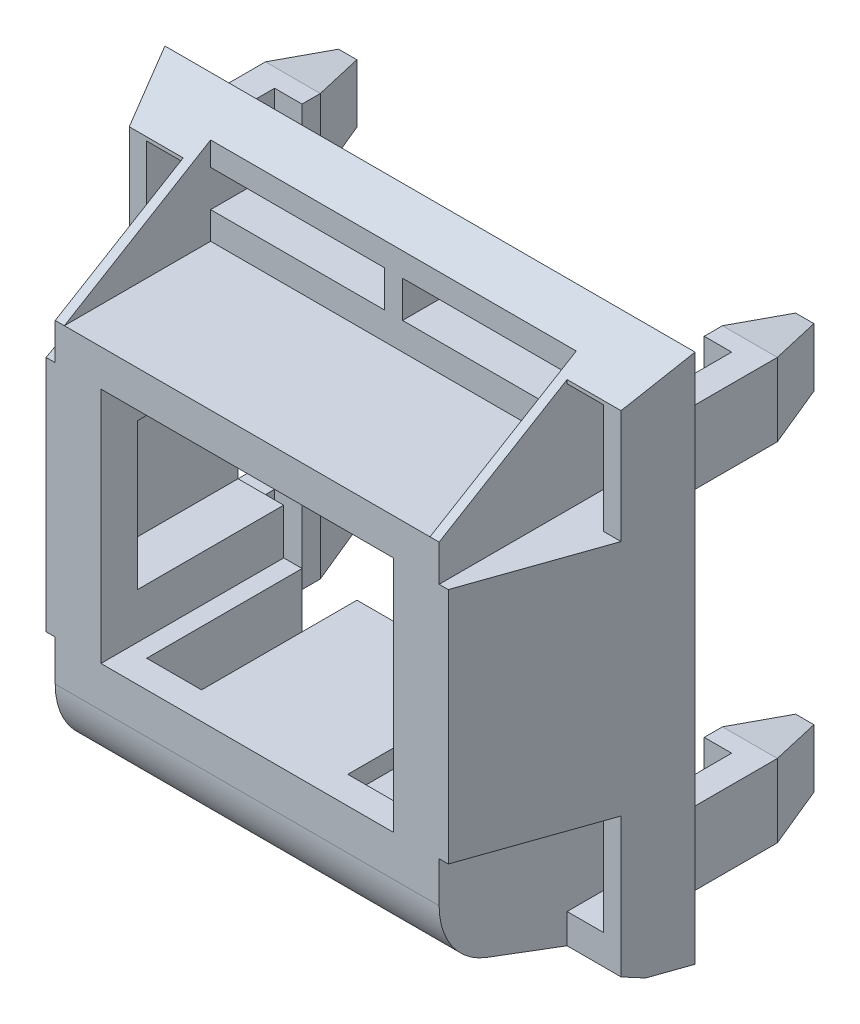
from build123d import *
from OCP.BRepFilletAPI import BRepFilletAPI_MakeChamfer

# Parameters (mm, degrees)
ESQUISSE1_W             = 14.5
ESQUISSE1_H             = 14.5
BOSS_EXTRU_1_DEPTH      = 5
ESQUISSE2_W             = 8
ESQUISSE2_H             = 6.5
ENL_V_MAT_EXTRU_1_DEPTH = 12.407234547
CHANFREIN1_SIZE         = 5
CHANFREIN1_SIZE_2       = 1.75
CHANFREIN2_SIZE         = 5
CHANFREIN2_SIZE_2       = 3
ESQUISSE3_W             = 2
ESQUISSE3_H             = 4
ENL_V_MAT_EXTRU_2_DEPTH = 3.5
ESQUISSE6_W             = 10
ESQUISSE6_H             = 3
ENL_V_MAT_EXTRU_3_DEPTH = 4
CHANFREIN3_SIZE         = 4
CHANFREIN3_SIZE2        = 1.5
CONG_1_R                = 2
ESQUISSE7_W             = 1.25
ESQUISSE7_H             = 4
ENL_V_MAT_EXTRU_4_DEPTH = 4
ESQUISSE8_W             = 1.5
ESQUISSE8_H             = 2
BOSS_EXTRU_2_DEPTH      = 4
CHANFREIN4_SIZE         = 0.2
CHANFREIN4_SIZE2        = 1.5
CHANFREIN5_SIZE         = 1.5
CHANFREIN5_SIZE2        = 0.2
CHANFREIN6_SIZE         = 0.5
CHANFREIN6_SIZE2        = 1.5
CHANFREIN7_SIZE         = 1.5
CHANFREIN7_SIZE2        = 0.5
ESQUISSE9_W             = 1
ESQUISSE9_H             = 3
ENL_V_MAT_EXTRU_5_DEPTH = 3.5
ESQUISSE10_W            = 4.75
ESQUISSE10_H            = 1
ENL_V_MAT_EXTRU_6_DEPTH = 12.407234547
ESQUISSE11_W            = 1.5
ESQUISSE11_H            = 0.5
ENL_V_MAT_EXTRU_7_DEPTH = 4.25
CONG_2_START            = -3.497851783
CONG_2_DEPTH            = 7


with BuildPart() as part:
    # Esquisse1 → Boss.-Extru.1 (new body)
    with BuildSketch(Plane.XY):
        Rectangle(ESQUISSE1_W, ESQUISSE1_H)
    extrude(amount=BOSS_EXTRU_1_DEPTH)

    # Esquisse2 → Enlèv. mat.-Extru.1 (cut, through all)
    with BuildSketch(Plane.XY.offset(5)):
        Rectangle(ESQUISSE2_W, ESQUISSE2_H)
    extrude(amount=-ENL_V_MAT_EXTRU_1_DEPTH, mode=Mode.SUBTRACT)

    # Chanfrein1
    # the kernel refuses this chamfer: 5, 1.75 mm, written as the material it takes off along each edge
    with BuildSketch(Plane(origin=(7.25, 20.222980747, 5), x_dir=(0, 0, -1), z_dir=(0, -1, 0)), Plane(origin=(-7.25, -20.222980747, 5), x_dir=(0, 0, -1), z_dir=(0, 1, 0))) as chanfrein1_piece_1:
        Polygon((CHANFREIN1_SIZE, 0), (0, -CHANFREIN1_SIZE_2), (0, 0), align=None)
    extrude(amount=40.445961493, mode=Mode.SUBTRACT)

    # Chanfrein2
    # the kernel refuses this chamfer: 5, 3 mm, written as the material it takes off along each edge
    with BuildSketch(Plane(origin=(-18.431305486, 7.25, 5), x_dir=(0, 0, -1), z_dir=(1, 0, 0))) as chanfrein2_piece_1:
        Polygon((CHANFREIN2_SIZE, 0), (0, -CHANFREIN2_SIZE_2), (0, 0), align=None)
    extrude(amount=36.862610972, mode=Mode.SUBTRACT)

    # Esquisse3 → Enlèv. mat.-Extru.2 (cut)
    with BuildSketch(Plane.XY.offset(5)):
        with Locations((-6.25, 5.25)):
            Rectangle(ESQUISSE3_W, ESQUISSE3_H)
        with Locations((6.25, 5.25)):
            Rectangle(ESQUISSE3_W, ESQUISSE3_H)
        with Locations((6.25, -5.25)):
            Rectangle(ESQUISSE3_W, ESQUISSE3_H)
        with Locations((-6.25, -5.25)):
            Rectangle(ESQUISSE3_W, ESQUISSE3_H)
    extrude(amount=-ENL_V_MAT_EXTRU_2_DEPTH, mode=Mode.SUBTRACT)

    # Esquisse6 → Enlèv. mat.-Extru.3 (cut)
    with BuildSketch(Plane.XY.offset(5)):
        with Locations((0, 5.75)):
            Rectangle(ESQUISSE6_W, ESQUISSE6_H)
    extrude(amount=-ENL_V_MAT_EXTRU_3_DEPTH, mode=Mode.SUBTRACT)

    # Chanfrein3
    chanfrein3_edges = [part.edges().sort_by_distance(p)[0] for p in [
        (0, -7.25, 5),
    ]]
    chanfrein3_side = [part.faces().sort_by_distance(p)[0] for p in [
        (0, -7.25, 2.338531514),
    ]]
    chamfer(chanfrein3_edges, length=CHANFREIN3_SIZE, length2=CHANFREIN3_SIZE2, reference=chanfrein3_side[0])

    # Congé1
    cong_1_edges = [part.edges().sort_by_distance(p)[0] for p in [
        (0, -5.75, 5),
    ]]
    fillet(cong_1_edges, radius=CONG_1_R)

    # Esquisse7 → Enlèv. mat.-Extru.4 (cut)
    with BuildSketch(Plane(origin=(0, 0, 0), x_dir=(-1, 0, 0), z_dir=(0, 0, -1))):
        with Locations((-4.625, 0)):
            Rectangle(ESQUISSE7_W, ESQUISSE7_H)
        with Locations((4.625, 0)):
            Rectangle(ESQUISSE7_W, ESQUISSE7_H)
    extrude(amount=-ENL_V_MAT_EXTRU_4_DEPTH, mode=Mode.SUBTRACT)

    # Esquisse8 → Boss.-Extru.2 (add)
    with BuildSketch(Plane(origin=(0, 0, 0), x_dir=(-1, 0, 0), z_dir=(0, 0, -1))):
        with Locations((-6.25, 4.75)):
            Rectangle(ESQUISSE8_W, ESQUISSE8_H)
        with Locations((6.25, 4.75)):
            Rectangle(ESQUISSE8_W, ESQUISSE8_H)
        with Locations((6.25, -4.75)):
            Rectangle(ESQUISSE8_W, ESQUISSE8_H)
        with Locations((-6.25, -4.75)):
            Rectangle(ESQUISSE8_W, ESQUISSE8_H)
    extrude(amount=BOSS_EXTRU_2_DEPTH)

    # Chanfrein4: one chamfer whose edges measure the first distance from different faces: ONE call of the kernel's chamfer builder (chamfer() names one face for all edges)
    chanfrein4_edges_1 = [part.edges().sort_by_distance(p)[0] for p in [
        (6.25, 5.75, -4),
    ]]
    chanfrein4_side_1 = [part.faces().sort_by_distance(p)[0] for p in [
        (6.25, 4.75, -4),
    ]]
    chanfrein4_edges_2 = [part.edges().sort_by_distance(p)[0] for p in [
        (-6.25, 3.75, -4),
        (-6.25, 5.75, -4),
    ]]
    chanfrein4_side_2 = [part.faces().sort_by_distance(p)[0] for p in [
        (-6.25, 4.75, -4),
    ]]
    chanfrein4_edges_3 = [part.edges().sort_by_distance(p)[0] for p in [
        (6.25, -3.75, -4),
    ]]
    chanfrein4_side_3 = [part.faces().sort_by_distance(p)[0] for p in [
        (6.25, -4.75, -4),
    ]]
    chanfrein4 = BRepFilletAPI_MakeChamfer(part.part.solid().wrapped)
    for e in chanfrein4_edges_1:
        chanfrein4.Add(CHANFREIN4_SIZE, CHANFREIN4_SIZE2, e.wrapped, chanfrein4_side_1[0].wrapped)  # the first distance lies on this face
    for e in chanfrein4_edges_2:
        chanfrein4.Add(CHANFREIN4_SIZE, CHANFREIN4_SIZE2, e.wrapped, chanfrein4_side_2[0].wrapped)  # the first distance lies on this face
    for e in chanfrein4_edges_3:
        chanfrein4.Add(CHANFREIN4_SIZE, CHANFREIN4_SIZE2, e.wrapped, chanfrein4_side_3[0].wrapped)  # the first distance lies on this face
    add(Compound.cast(chanfrein4.Shape()), mode=Mode.REPLACE)

    # Chanfrein5: one chamfer whose edges measure the first distance from different faces: ONE call of the kernel's chamfer builder (chamfer() names one face for all edges)
    chanfrein5_edges_1 = [part.edges().sort_by_distance(p)[0] for p in [
        (6.25, 3.75, -4),
    ]]
    chanfrein5_side_1 = [part.faces().sort_by_distance(p)[0] for p in [
        (6.25, 3.75, -2),
    ]]
    chanfrein5_edges_2 = [part.edges().sort_by_distance(p)[0] for p in [
        (-6.25, -5.75, -4),
    ]]
    chanfrein5_side_2 = [part.faces().sort_by_distance(p)[0] for p in [
        (-6.25, -5.75, -2),
    ]]
    chanfrein5_edges_3 = [part.edges().sort_by_distance(p)[0] for p in [
        (-6.25, -3.75, -4),
    ]]
    chanfrein5_side_3 = [part.faces().sort_by_distance(p)[0] for p in [
        (-6.25, -3.75, -2),
    ]]
    chanfrein5_edges_4 = [part.edges().sort_by_distance(p)[0] for p in [
        (6.25, -5.75, -4),
    ]]
    chanfrein5_side_4 = [part.faces().sort_by_distance(p)[0] for p in [
        (6.25, -5.75, -2),
    ]]
    chanfrein5 = BRepFilletAPI_MakeChamfer(part.part.solid().wrapped)
    for e in chanfrein5_edges_1:
        chanfrein5.Add(CHANFREIN5_SIZE, CHANFREIN5_SIZE2, e.wrapped, chanfrein5_side_1[0].wrapped)  # the first distance lies on this face
    for e in chanfrein5_edges_2:
        chanfrein5.Add(CHANFREIN5_SIZE, CHANFREIN5_SIZE2, e.wrapped, chanfrein5_side_2[0].wrapped)  # the first distance lies on this face
    for e in chanfrein5_edges_3:
        chanfrein5.Add(CHANFREIN5_SIZE, CHANFREIN5_SIZE2, e.wrapped, chanfrein5_side_3[0].wrapped)  # the first distance lies on this face
    for e in chanfrein5_edges_4:
        chanfrein5.Add(CHANFREIN5_SIZE, CHANFREIN5_SIZE2, e.wrapped, chanfrein5_side_4[0].wrapped)  # the first distance lies on this face
    add(Compound.cast(chanfrein5.Shape()), mode=Mode.REPLACE)

    # Chanfrein6: one chamfer whose edges measure the first distance from different faces: ONE call of the kernel's chamfer builder (chamfer() names one face for all edges)
    chanfrein6_edges_1 = [part.edges().sort_by_distance(p)[0] for p in [
        (5.5, 4.75, -4),
    ]]
    chanfrein6_side_1 = [part.faces().sort_by_distance(p)[0] for p in [
        (6.25, 4.75, -4),
    ]]
    chanfrein6_edges_2 = [part.edges().sort_by_distance(p)[0] for p in [
        (-7, 4.75, -4),
    ]]
    chanfrein6_side_2 = [part.faces().sort_by_distance(p)[0] for p in [
        (-6.25, 4.75, -4),
    ]]
    chanfrein6_edges_3 = [part.edges().sort_by_distance(p)[0] for p in [
        (-5.5, -4.75, -4),
        (-7, -4.75, -4),
    ]]
    chanfrein6_side_3 = [part.faces().sort_by_distance(p)[0] for p in [
        (-6.25, -4.75, -4),
    ]]
    chanfrein6 = BRepFilletAPI_MakeChamfer(part.part.solid().wrapped)
    for e in chanfrein6_edges_1:
        chanfrein6.Add(CHANFREIN6_SIZE, CHANFREIN6_SIZE2, e.wrapped, chanfrein6_side_1[0].wrapped)  # the first distance lies on this face
    for e in chanfrein6_edges_2:
        chanfrein6.Add(CHANFREIN6_SIZE, CHANFREIN6_SIZE2, e.wrapped, chanfrein6_side_2[0].wrapped)  # the first distance lies on this face
    for e in chanfrein6_edges_3:
        chanfrein6.Add(CHANFREIN6_SIZE, CHANFREIN6_SIZE2, e.wrapped, chanfrein6_side_3[0].wrapped)  # the first distance lies on this face
    add(Compound.cast(chanfrein6.Shape()), mode=Mode.REPLACE)

    # Chanfrein7: one chamfer whose edges measure the first distance from different faces: ONE call of the kernel's chamfer builder (chamfer() names one face for all edges)
    chanfrein7_edges_1 = [part.edges().sort_by_distance(p)[0] for p in [
        (5.5, -4.75, -4),
    ]]
    chanfrein7_side_1 = [part.faces().sort_by_distance(p)[0] for p in [
        (5.5, -4.75, -1.941558442),
    ]]
    chanfrein7_edges_2 = [part.edges().sort_by_distance(p)[0] for p in [
        (-5.5, 4.75, -4),
    ]]
    chanfrein7_side_2 = [part.faces().sort_by_distance(p)[0] for p in [
        (-5.5, 4.75, -1.941558442),
    ]]
    chanfrein7_edges_3 = [part.edges().sort_by_distance(p)[0] for p in [
        (7, 4.75, -4),
    ]]
    chanfrein7_side_3 = [part.faces().sort_by_distance(p)[0] for p in [
        (7, 4.75, -1.941558442),
    ]]
    chanfrein7_edges_4 = [part.edges().sort_by_distance(p)[0] for p in [
        (7, -4.75, -4),
    ]]
    chanfrein7_side_4 = [part.faces().sort_by_distance(p)[0] for p in [
        (7, -4.75, -1.941558442),
    ]]
    chanfrein7 = BRepFilletAPI_MakeChamfer(part.part.solid().wrapped)
    for e in chanfrein7_edges_1:
        chanfrein7.Add(CHANFREIN7_SIZE, CHANFREIN7_SIZE2, e.wrapped, chanfrein7_side_1[0].wrapped)  # the first distance lies on this face
    for e in chanfrein7_edges_2:
        chanfrein7.Add(CHANFREIN7_SIZE, CHANFREIN7_SIZE2, e.wrapped, chanfrein7_side_2[0].wrapped)  # the first distance lies on this face
    for e in chanfrein7_edges_3:
        chanfrein7.Add(CHANFREIN7_SIZE, CHANFREIN7_SIZE2, e.wrapped, chanfrein7_side_3[0].wrapped)  # the first distance lies on this face
    for e in chanfrein7_edges_4:
        chanfrein7.Add(CHANFREIN7_SIZE, CHANFREIN7_SIZE2, e.wrapped, chanfrein7_side_4[0].wrapped)  # the first distance lies on this face
    add(Compound.cast(chanfrein7.Shape()), mode=Mode.REPLACE)

    # Esquisse9 → Enlèv. mat.-Extru.5 (cut)
    with BuildSketch(Plane.XY.offset(1.5)):
        with Locations((-5.75, 4.75)):
            Rectangle(ESQUISSE9_W, ESQUISSE9_H)
        with Locations((-5.75, -4.75)):
            Rectangle(ESQUISSE9_W, ESQUISSE9_H)
        with Locations((5.75, -4.75)):
            Rectangle(ESQUISSE9_W, ESQUISSE9_H)
        with Locations((5.75, 4.75)):
            Rectangle(ESQUISSE9_W, ESQUISSE9_H)
    extrude(amount=-ENL_V_MAT_EXTRU_5_DEPTH, mode=Mode.SUBTRACT)

    # Esquisse10 → Enlèv. mat.-Extru.6 (cut, through all)
    with BuildSketch(Plane.XY.offset(1)):
        with Locations((-2.625, 5.5)):
            Rectangle(ESQUISSE10_W, ESQUISSE10_H)
        with Locations((2.625, 5.5)):
            Rectangle(ESQUISSE10_W, ESQUISSE10_H)
    extrude(amount=-ENL_V_MAT_EXTRU_6_DEPTH, mode=Mode.SUBTRACT)

    # Esquisse11 → Enlèv. mat.-Extru.7 (cut)
    with BuildSketch(Plane(origin=(0, 0, 0), x_dir=(-1, 0, 0), z_dir=(0, 0, -1))):
        Polygon((-3.502148217, -3.75), (-3.502148217, -5.75), (0, -5.75), (3.497851783, -5.75), (3.497851783, -3.75), align=None)
        with Locations((2.747851783, -3.5)):
            Rectangle(ESQUISSE11_W, ESQUISSE11_H)
        with Locations((-2.752148217, -3.5)):
            Rectangle(ESQUISSE11_W, ESQUISSE11_H)
    extrude(amount=-ENL_V_MAT_EXTRU_7_DEPTH, mode=Mode.SUBTRACT)

    # Congé2: read off the stored shape, not the designer's step
    # Congé2 outline → Congé2 (add)
    with BuildSketch(Plane.YZ.offset(CONG_2_START)):
        with BuildLine():
            Line((-5.75, 4.25), (-5.75, 2.25))
            ThreePointArc((-5.75, 2.25), (-5.164213562, 3.664213562), (-3.75, 4.25))
            Line((-3.75, 4.25), (-5.75, 4.25))
        make_face()
    extrude(amount=CONG_2_DEPTH)


solid = part.part
